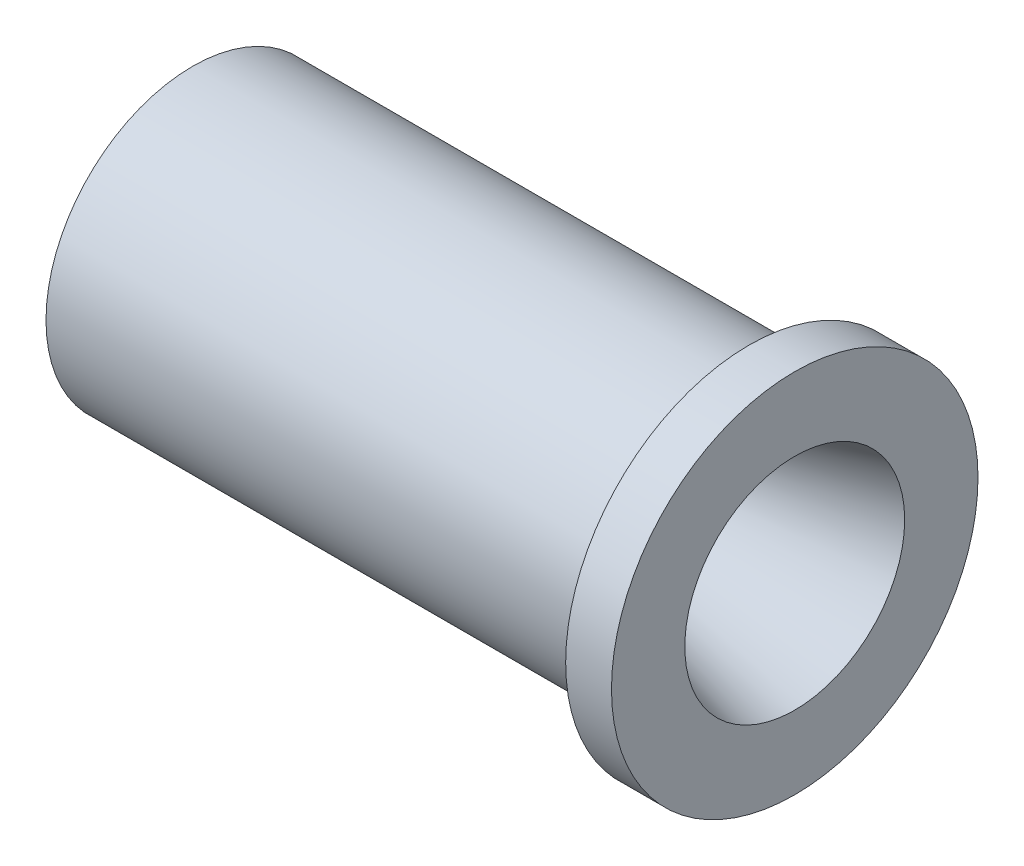
from build123d import *


with BuildPart() as part:
    # Sketch1 → Revolve1 (revolve)
    with BuildSketch(Plane.XY):
        Polygon((-16.759113577, 5.08), (-6.599113577, 5.08), (0, 1.27), (1.27, 1.27), (24.968522628, 7.62), (24.968522628, 12.7), (21.793522628, 12.7), (21.793522628, 10.16), (-16.759113577, 10.16), align=None)
    revolve(axis=Axis((0, 0, 0), (1, 0, 0)))


solid = part.part
